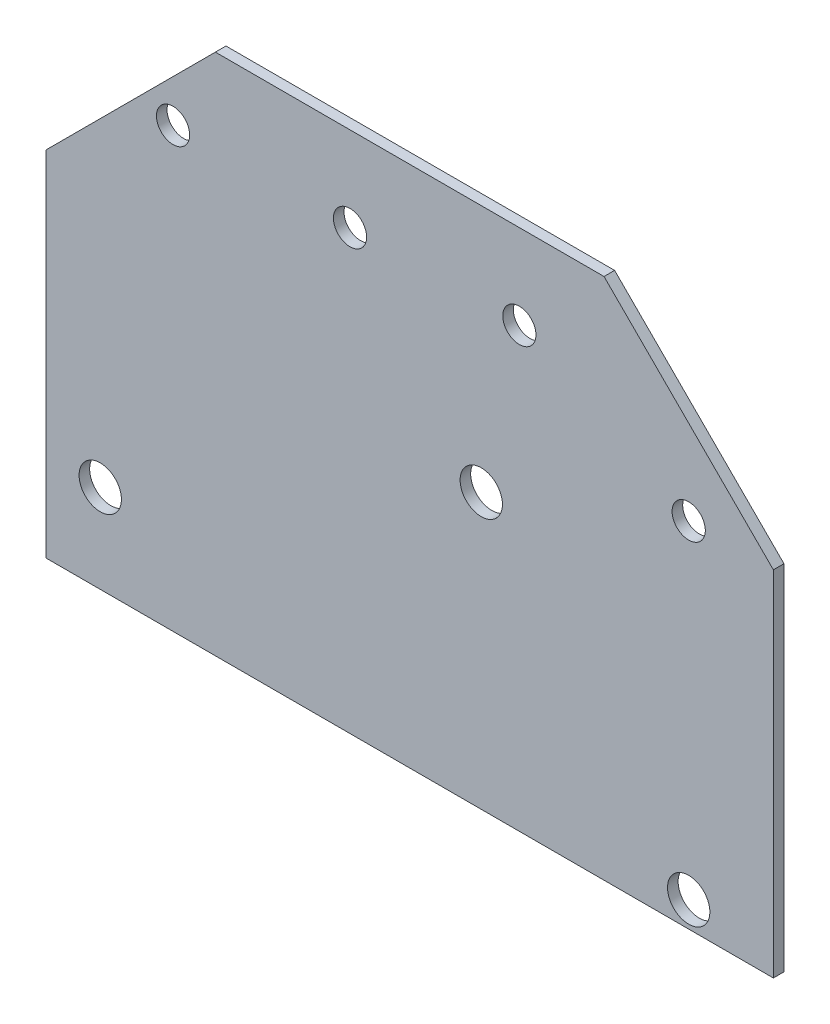
from build123d import *

# Parameters (mm, degrees)
BOSS_EXTRUDE1_DEPTH         = 1.5875
F_10_CLEARANCE_HOLE1_D      = 4.9784
F_1_4_0_25_DIAMETER_HOLE1_D = 6.35
F_1_4_0_25_DIAMETER_HOLE2_D = 6.35


with BuildPart() as part:
    # Sketch1 → Boss-Extrude1 (new body)
    with BuildSketch(Plane.XY):
        Polygon((233.807000506, -12.7), (233.807000506, -65.722500005), (342.900001011, -65.722500005), (342.900001011, -12.7), (317.500001011, 12.7), (259.207000506, 12.7), align=None)
    extrude(amount=BOSS_EXTRUDE1_DEPTH)

    # #10 Clearance Hole1 (through all)
    with Locations(Plane(origin=(0, 0, 0), x_dir=(-1, 0, 0), z_dir=(0, 0, -1))):
        with Locations((-330.199999492, -12.699999999), (-304.799999492, 0), (-279.399999492, -1e-09), (-252.857001024, 3.9e-08)):
            Hole(F_10_CLEARANCE_HOLE1_D / 2)

    # 1/4 (0.25) Diameter Hole1 (through all)
    with Locations(Plane(origin=(0, 0, 0), x_dir=(-1, 0, 0), z_dir=(0, 0, -1))):
        with Locations((-330.200001005, -61.912499999)):
            Hole(F_1_4_0_25_DIAMETER_HOLE1_D / 2)

    # 1/4 (0.25) Diameter Hole2 (through all)
    with Locations(Plane.XY.offset(1.5875)):
        with Locations((299.085001004, -24.525188439), (241.935001005, -52.465188442)):
            Hole(F_1_4_0_25_DIAMETER_HOLE2_D / 2)


solid = part.part
